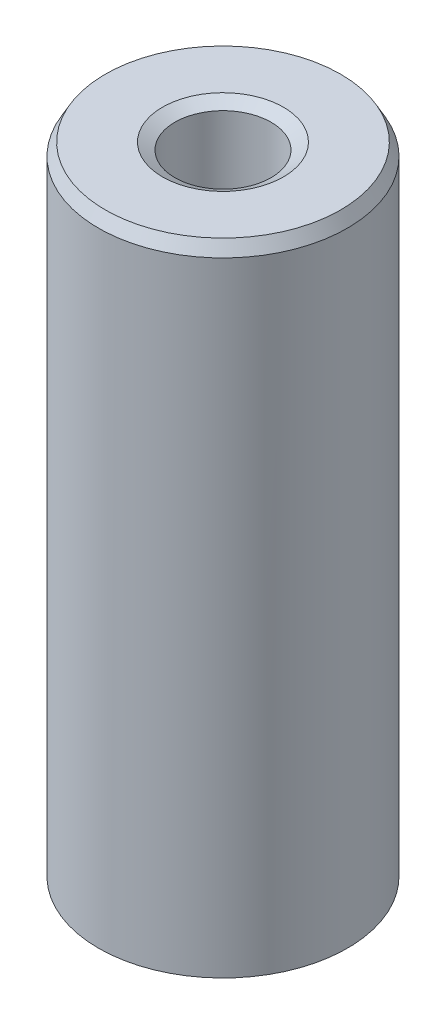
from build123d import *
from OCP.BRepFilletAPI import BRepFilletAPI_MakeChamfer

# Parameters (mm, degrees)
SKETCH1_R           = 7.5
BOSS_EXTRUDE1_DEPTH = 38.726570082
SKETCH2_R           = 2.898609138
CUT_EXTRUDE1_DEPTH  = 41.152798536
CHAMFER1_SIZE       = 0.744804351
CHAMFER1_SIZE2      = 0.412156138


with BuildPart() as part:
    # Sketch1 → Boss-Extrude1 (new body)
    with BuildSketch(Plane(origin=(0, 0, 0), x_dir=(1, 0, 0), z_dir=(0, 1, 0))):
        Circle(SKETCH1_R)
    extrude(amount=BOSS_EXTRUDE1_DEPTH)

    # Sketch2 → Cut-Extrude1 (cut, through all)
    with BuildSketch(Plane(origin=(0, 0, 0), x_dir=(1, 0, 0), z_dir=(0, 1, 0))):
        Circle(SKETCH2_R)
    extrude(amount=CUT_EXTRUDE1_DEPTH, mode=Mode.SUBTRACT)

    # Chamfer1: one chamfer whose edges measure the first distance from different faces: ONE call of the kernel's chamfer builder (chamfer() names one face for all edges)
    chamfer1_edges_1 = [part.edges().sort_by_distance(p)[0] for p in [
        (-2.898609138, 38.726570082, 0),
    ]]
    chamfer1_side_1 = [part.faces().sort_by_distance(p)[0] for p in [
        (-7.287867966, 38.726570082, 0),
    ]]
    chamfer1_edges_2 = [part.edges().sort_by_distance(p)[0] for p in [
        (-2.898609138, 0, 0),
    ]]
    chamfer1_side_2 = [part.faces().sort_by_distance(p)[0] for p in [
        (-2.898609138, 19.363285041, 0),
    ]]
    chamfer1_edges_3 = [part.edges().sort_by_distance(p)[0] for p in [
        (-7.5, 0, 0),
    ]]
    chamfer1_side_3 = [part.faces().sort_by_distance(p)[0] for p in [
        (-7.287867966, 0, 0),
    ]]
    chamfer1_edges_4 = [part.edges().sort_by_distance(p)[0] for p in [
        (-7.5, 38.726570082, 0),
    ]]
    chamfer1_side_4 = [part.faces().sort_by_distance(p)[0] for p in [
        (-7.5, 19.363285041, 0),
    ]]
    chamfer1 = BRepFilletAPI_MakeChamfer(part.part.solid().wrapped)
    for e in chamfer1_edges_1:
        chamfer1.Add(CHAMFER1_SIZE, CHAMFER1_SIZE2, e.wrapped, chamfer1_side_1[0].wrapped)  # the first distance lies on this face
    for e in chamfer1_edges_2:
        chamfer1.Add(CHAMFER1_SIZE, CHAMFER1_SIZE2, e.wrapped, chamfer1_side_2[0].wrapped)  # the first distance lies on this face
    for e in chamfer1_edges_3:
        chamfer1.Add(CHAMFER1_SIZE, CHAMFER1_SIZE2, e.wrapped, chamfer1_side_3[0].wrapped)  # the first distance lies on this face
    for e in chamfer1_edges_4:
        chamfer1.Add(CHAMFER1_SIZE, CHAMFER1_SIZE2, e.wrapped, chamfer1_side_4[0].wrapped)  # the first distance lies on this face
    add(Compound.cast(chamfer1.Shape()), mode=Mode.REPLACE)


solid = part.part
